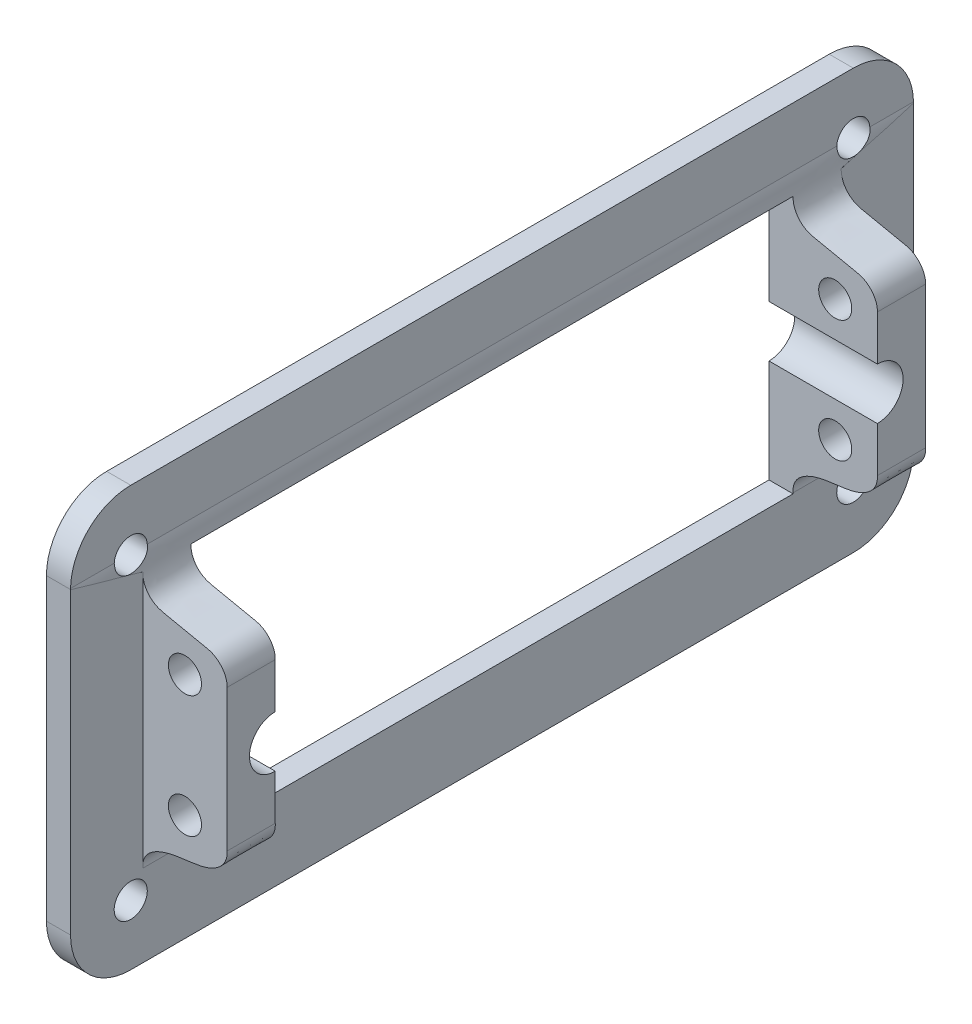
from build123d import *

# Parameters (mm, degrees)
BOSS_EXTRUDE1_DEPTH = 140
SKETCH3_W           = 100.000033612
SKETCH3_H           = 42.774943194
SKETCH3_R           = 2.750004799
SKETCH3_R_2         = 2.750148444
SKETCH3_R_3         = 2.750082905
CUT_EXTRUDE2_DEPTH  = 146.390945578
BOSS_EXTRUDE2_DEPTH = 4
FILLET1_R           = 10


with BuildPart() as part:
    # Sketch1 → Boss-Extrude1 (new body)
    with BuildSketch(Plane.XY):
        with BuildLine():
            Line((0, 34.84618), (4, 34.84618))
            Line((4, 34.84618), (4, 25))
            add(Edge.make_bspline(
                [(4, 25), (4.285745964, 23.385585674), (3.334165768, 20.530299656), (5.86942967, 17.401645573), (8.597828968, 17.049617754), (11.245203287, 16.443307294), (13.444911229, 15.943455224), (16.528382386, 15.432026327), (18.071050337, 13.358912011), (18, 11.76634)],
                knots=[0, 0, 0, 0, 0.22884802, 0.348280335, 0.486981239, 0.584132694, 0.71556526, 0.790229605, 1, 1, 1, 1], degree=3))
            Line((18, 11.76634), (18, -11.76634))
            add(Edge.make_bspline(
                [(18, -11.76634), (18.11487863, -13.547247778), (15.700218007, -16.005987398), (11.196556698, -16.437759914), (6.662255087, -17.114665785), (3.848184267, -19.106242891), (4, -21.23366)],
                knots=[0, 0, 0, 0, 0.252594817, 0.500731717, 0.71236885, 1, 1, 1, 1], degree=3))
            Line((4, -21.23366), (4, -34.84618))
            Line((4, -34.84618), (0, -34.84618))
            Line((0, -34.84618), (0, 34.84618))
        make_face()
        with BuildLine():
            ThreePointArc((11, 12.874999633), (8.893378216, 8.357332848), (13.708221742, 9.647468633))
            ThreePointArc((13.708221742, 9.647468633), (13.106621784, 11.892666152), (11, 12.874999633))
        make_face(mode=Mode.SUBTRACT)
        with BuildLine():
            ThreePointArc((11, -7.375000367), (13.252661946, -8.547656249), (13.584162327, -11.065535349))
            ThreePointArc((13.584162327, -11.065535349), (8.747338054, -11.702344751), (11, -7.375000367))
        make_face(mode=Mode.SUBTRACT)
    extrude(amount=-BOSS_EXTRUDE1_DEPTH)

    # Sketch3 → Cut-Extrude2 (cut, through all)
    with BuildSketch(Plane(origin=(0, 0, 0), x_dir=(0, 0, -1), z_dir=(1, 0, 0))):
        Polygon((140, -24.846188403), (140, 24.846188403), (128.000016806, 21.387471597), (128.000016806, -21.387471597), align=None)
        Polygon((11.999983194, -21.387471597), (0, -24.846188403), (0, 24.846188403), (11.999983194, 21.387471597), align=None)
        with BuildLine():
            ThreePointArc((120.000016806, -4.278800191), (124.278816998, 0), (120.000016806, 4.278800191))
            Line((120.000016806, 4.278800191), (120.000016806, -4.278800191))
        make_face()
        with BuildLine():
            Line((19.999983194, -4.278800191), (19.999983194, 4.278800191))
            ThreePointArc((19.999983194, 4.278800191), (15.721183002, 0), (19.999983194, -4.278800191))
        make_face()
        with Locations((70, 0)):
            Rectangle(SKETCH3_W, SKETCH3_H)
        with Locations(Location((9.999991597, -24.846188403, 0), (0, 0, 90))):
            Circle(SKETCH3_R)
        with Locations(Location((129.999911703, -24.846188403, 0), (0, 0, 90))):
            Circle(SKETCH3_R_2)
        with Locations(Location((9.999991597, 24.846188403, 0), (0, 0, 176.793694076))):
            Circle(SKETCH3_R)
        with Locations(Location((129.999911703, 24.846188403, 0), (0, 0, 176.793785235))):
            Circle(SKETCH3_R_3)
    extrude(amount=CUT_EXTRUDE2_DEPTH, mode=Mode.SUBTRACT)

    # Sketch3<3> → Boss-Extrude2 (add)
    with BuildSketch(Plane(origin=(0, 0, 0), x_dir=(0, 0, -1), z_dir=(1, 0, 0))):
        Polygon((11.999983194, 21.387471597), (0, 24.846188403), (0, -24.846188403), (11.999983194, -21.387471597), align=None)
        Polygon((140, -24.846188403), (140, 24.846188403), (128.000016806, 21.387471597), (128.000016806, -21.387471597), align=None)
    extrude(amount=BOSS_EXTRUDE2_DEPTH)

    # Fillet1
    # the kernel refuses this fillet: 10 mm, written as the material it takes off along each edge
    with BuildSketch(Plane(origin=(-25, 34.84618, 0), x_dir=(0, 0, -1), z_dir=(1, 0, 0)), Plane(origin=(29, -34.84618, -140), x_dir=(0, 1, 0), z_dir=(-1, 0, 0)), Plane(origin=(29, -34.84618, 0), x_dir=(0, 0, -1), z_dir=(-1, 0, 0))) as fillet1_piece_1:
        with BuildLine():
            CenterArc((FILLET1_R, -FILLET1_R), FILLET1_R, 90, 90)
            Line((0, -FILLET1_R), (0, 0))
            Line((0, 0), (FILLET1_R, 0))
        make_face()
    extrude(amount=54, mode=Mode.SUBTRACT)
    with BuildSketch(Plane(origin=(-25, 34.84618, -140), x_dir=(0, 0, 1), z_dir=(1, 0, 0))) as fillet1_piece_2:
        with BuildLine():
            CenterArc((FILLET1_R, FILLET1_R), FILLET1_R, 180, 90)
            Line((0, FILLET1_R), (0, 0))
            Line((0, 0), (FILLET1_R, 0))
        make_face()
    extrude(amount=54, mode=Mode.SUBTRACT)


solid = part.part
